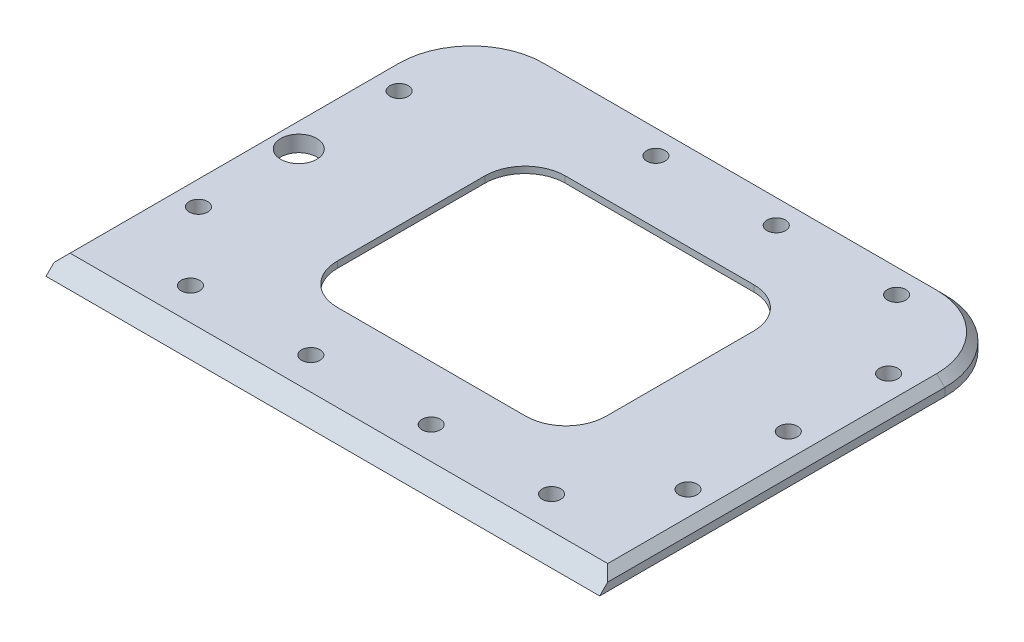
from build123d import *

# Parameters (mm, degrees)
SKETCH_1_W          = 69
SKETCH_1_H          = 51
SKETCH_1_R          = 1.15
SKETCH_1_W_2        = 39.5
SKETCH_1_H_2        = 32.4
EXTRUDE_1_DEPTH     = 2
FILLET_1_R          = 10
FILLET_2_R          = 5
EXTRUDE_2_DEPTH     = 0.8
EXTRUDE_4_DEPTH     = 69
CHAMFER_1_SIZE      = 1
EXTRUDE_3_DEPTH     = 1
SKETCH_5_W          = 1.5
SKETCH_5_H          = 18
CUT_EXTRUDE_1_DEPTH = 1
CHAMFER_2_SIZE      = 1
CUT_EXTRUDE_2_REACH = 87.855
SKETCH_7_R          = 2.25


with BuildPart() as part:
    # 草图1 → 凸台-拉伸1 (new body)
    with BuildSketch(Plane(origin=(0, 0, 0), x_dir=(1, 0, 0), z_dir=(0, 1, 0))):
        with Locations((34.5, 25.5)):
            Rectangle(SKETCH_1_W, SKETCH_1_H)
        with Locations(Location((4, 25.5, 0), (0, 0, 270))):
            Circle(SKETCH_1_R, mode=Mode.SUBTRACT)
        with Locations(Location((65, 25.5, 0), (0, 0, 270))):
            Circle(SKETCH_1_R, mode=Mode.SUBTRACT)
        with Locations(Location((27, 47, 0), (0, 0, 270))):
            Circle(SKETCH_1_R, mode=Mode.SUBTRACT)
        with Locations(Location((42, 47, 0), (0, 0, 270))):
            Circle(SKETCH_1_R, mode=Mode.SUBTRACT)
        with Locations(Location((42, 4, 0), (0, 0, 90))):
            Circle(SKETCH_1_R, mode=Mode.SUBTRACT)
        with Locations(Location((27, 4, 0), (0, 0, 90))):
            Circle(SKETCH_1_R, mode=Mode.SUBTRACT)
        with Locations(Location((4, 38, 0), (0, 0, 270))):
            Circle(SKETCH_1_R, mode=Mode.SUBTRACT)
        with Locations(Location((4, 13, 0), (0, 0, 90))):
            Circle(SKETCH_1_R, mode=Mode.SUBTRACT)
        with Locations(Location((65, 13, 0), (0, 0, 270))):
            Circle(SKETCH_1_R, mode=Mode.SUBTRACT)
        with Locations(Location((65, 38, 0), (0, 0, 90))):
            Circle(SKETCH_1_R, mode=Mode.SUBTRACT)
        with Locations(Location((57, 47, 0), (0, 0, 270))):
            Circle(SKETCH_1_R, mode=Mode.SUBTRACT)
        with Locations(Location((57, 4, 0), (0, 0, 90))):
            Circle(SKETCH_1_R, mode=Mode.SUBTRACT)
        with Locations(Location((12, 4, 0), (0, 0, 270))):
            Circle(SKETCH_1_R, mode=Mode.SUBTRACT)
        with Locations((34.25, 25.5)):
            Rectangle(SKETCH_1_W_2, SKETCH_1_H_2, mode=Mode.SUBTRACT)
    extrude(amount=EXTRUDE_1_DEPTH)

    # 圆角1
    fillet_1_edges = [part.edges().sort_by_distance(p)[0] for p in [
        (0, 1, -51),
        (69, 1, -51),
    ]]
    fillet(fillet_1_edges, radius=FILLET_1_R)

    # 圆角2
    fillet_2_edges = [part.edges().sort_by_distance(p)[0] for p in [
        (14.5, 1, -41.7),
        (14.5, 1, -9.3),
        (54, 1, -9.3),
        (54, 1, -41.7),
    ]]
    fillet(fillet_2_edges, radius=FILLET_2_R)

    # 草图2 → 凸台-拉伸2 (add)
    with BuildSketch(Plane(origin=(0, 2, 0), x_dir=(1, 0, 0), z_dir=(0, 1, 0))):
        with BuildLine():
            Line((54, 14.3), (54, 36.7))
            ThreePointArc((54, 36.7), (52.535533906, 40.235533906), (49, 41.7))
            Line((49, 41.7), (19.5, 41.7))
            ThreePointArc((19.5, 41.7), (15.964466094, 40.235533906), (14.5, 36.7))
            Line((14.5, 36.7), (14.5, 14.3))
            ThreePointArc((14.5, 14.3), (15.964466094, 10.764466094), (19.5, 9.3))
            Line((19.5, 9.3), (49, 9.3))
            ThreePointArc((49, 9.3), (52.535533906, 10.764466094), (54, 14.3))
        make_face()
        with BuildLine():
            Line((23.5, 39.2), (47, 39.2))
            ThreePointArc((47, 39.2), (50.535533906, 37.735533906), (52, 34.2))
            Line((52, 34.2), (52, 15.8))
            ThreePointArc((52, 15.8), (50.535533906, 12.264466094), (47, 10.8))
            Line((47, 10.8), (23.5, 10.8))
            ThreePointArc((23.5, 10.8), (19.964466094, 12.264466094), (18.5, 15.8))
            Line((18.5, 15.8), (18.5, 34.2))
            ThreePointArc((18.5, 34.2), (19.964466094, 37.735533906), (23.5, 39.2))
        make_face(mode=Mode.SUBTRACT)
    extrude(amount=-EXTRUDE_2_DEPTH)

    # 草图4 → 凸台-拉伸4 (add)
    with BuildSketch(Plane(origin=(69, 0, 0), x_dir=(0, 0, -1), z_dir=(1, 0, 0))):
        Polygon((0, 2), (-2, 0), (0, 0), align=None)
    extrude(amount=-EXTRUDE_4_DEPTH)

    # 倒角1
    chamfer_1_edges = [part.edges().sort_by_distance(p)[0] for p in [
        (69, 2, -20.5),
        (34.5, 2, -51),
        (0, 2, -20.5),
        (2.928932188, 2, -48.071067812),
        (66.071067812, 2, -48.071067812),
    ]]
    chamfer(chamfer_1_edges, length=CHAMFER_1_SIZE)

    # 草图3 → 凸台-拉伸3 (add)
    with BuildSketch(Plane.XZ):
        with BuildLine():
            ThreePointArc((17, -8.3), (14.091673087, -10.694448725), (13, -14.3))
            Line((13, -14.3), (13, -36.7))
            ThreePointArc((13, -36.7), (14.091673087, -40.305551275), (17, -42.7))
            Line((17, -42.7), (51.5, -42.7))
            ThreePointArc((51.5, -42.7), (54.408326913, -40.305551275), (55.5, -36.7))
            Line((55.5, -36.7), (55.5, -14.3))
            ThreePointArc((55.5, -14.3), (54.408326913, -10.694448725), (51.5, -8.3))
            Line((51.5, -8.3), (17, -8.3))
        make_face()
        with BuildLine():
            Line((54, -14.3), (54, -36.7))
            ThreePointArc((54, -36.7), (52.535533906, -40.235533906), (49, -41.7))
            Line((49, -41.7), (19.5, -41.7))
            ThreePointArc((19.5, -41.7), (15.964466094, -40.235533906), (14.5, -36.7))
            Line((14.5, -36.7), (14.5, -14.3))
            ThreePointArc((14.5, -14.3), (15.964466094, -10.764466094), (19.5, -9.3))
            Line((19.5, -9.3), (49, -9.3))
            ThreePointArc((49, -9.3), (52.535533906, -10.764466094), (54, -14.3))
        make_face(mode=Mode.SUBTRACT)
    extrude(amount=EXTRUDE_3_DEPTH)

    # 草图5 → 切除-拉伸1 (cut)
    with BuildSketch(Plane.XZ):
        with Locations((13.75, -25.5)):
            Rectangle(SKETCH_5_W, SKETCH_5_H)
    extrude(amount=CUT_EXTRUDE_1_DEPTH, mode=Mode.SUBTRACT)

    # 倒角2
    chamfer_2_edges = [part.edges().sort_by_distance(p)[0] for p in [
        (13.75, 0, -34.5),
        (13.75, 0, -16.5),
    ]]
    chamfer(chamfer_2_edges, length=CHAMFER_2_SIZE - 0.0001)  # a hair under: the kernel refuses the full size

    # 草图7 → 切除-拉伸2 (cut, up to next)
    with BuildSketch(Plane(origin=(0, 2, 0), x_dir=(1, 0, 0), z_dir=(0, 1, 0)), mode=Mode.PRIVATE) as cut_extrude_2_sk1:
        with Locations(Location((4, 25.5, 0), (0, 0, 270))):
            Circle(SKETCH_7_R)
    cut_extrude_2_tool1 = extrude(cut_extrude_2_sk1.sketch, amount=-CUT_EXTRUDE_2_REACH, mode=Mode.PRIVATE) & part.part
    add(cut_extrude_2_tool1.solids().sort_by_distance((4, 2, -25.5))[0], mode=Mode.SUBTRACT)


solid = part.part
